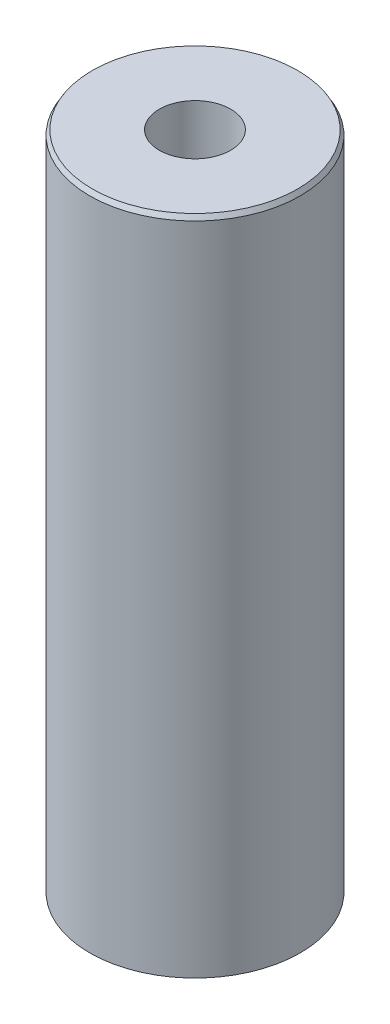
from build123d import *
from OCP.BRepFilletAPI import BRepFilletAPI_MakeChamfer

# Parameters (mm, degrees)
SKETCH1_R           = 57.5
BOSS_EXTRUDE1_DEPTH = 361.898156727
SKETCH2_R           = 19.480696806
CUT_EXTRUDE1_DEPTH  = 371.921522484
CHAMFER1_SIZE       = 2.523620869
CHAMFER1_SIZE2      = 1.457013188


with BuildPart() as part:
    # Sketch1 → Boss-Extrude1 (new body)
    with BuildSketch(Plane(origin=(0, 0, 0), x_dir=(1, 0, 0), z_dir=(0, 1, 0))):
        Circle(SKETCH1_R)
    extrude(amount=BOSS_EXTRUDE1_DEPTH)

    # Sketch2 → Cut-Extrude1 (cut, through all)
    with BuildSketch(Plane(origin=(0, 0, 0), x_dir=(1, 0, 0), z_dir=(0, 1, 0))):
        Circle(SKETCH2_R)
    extrude(amount=CUT_EXTRUDE1_DEPTH, mode=Mode.SUBTRACT)

    # Chamfer1: one chamfer whose edges measure the first distance from different faces: ONE call of the kernel's chamfer builder (chamfer() names one face for all edges)
    chamfer1_edges_1 = [part.edges().sort_by_distance(p)[0] for p in [
        (-57.5, 361.898156727, 0),
    ]]
    chamfer1_side_1 = [part.faces().sort_by_distance(p)[0] for p in [
        (-57.5, 180.949078363, 0),
    ]]
    chamfer1_edges_2 = [part.edges().sort_by_distance(p)[0] for p in [
        (-57.5, 0, 0),
    ]]
    chamfer1_side_2 = [part.faces().sort_by_distance(p)[0] for p in [
        (-55.873654403, 0, 0),
    ]]
    chamfer1 = BRepFilletAPI_MakeChamfer(part.part.solid().wrapped)
    for e in chamfer1_edges_1:
        chamfer1.Add(CHAMFER1_SIZE, CHAMFER1_SIZE2, e.wrapped, chamfer1_side_1[0].wrapped)  # the first distance lies on this face
    for e in chamfer1_edges_2:
        chamfer1.Add(CHAMFER1_SIZE, CHAMFER1_SIZE2, e.wrapped, chamfer1_side_2[0].wrapped)  # the first distance lies on this face
    add(Compound.cast(chamfer1.Shape()), mode=Mode.REPLACE)


solid = part.part
